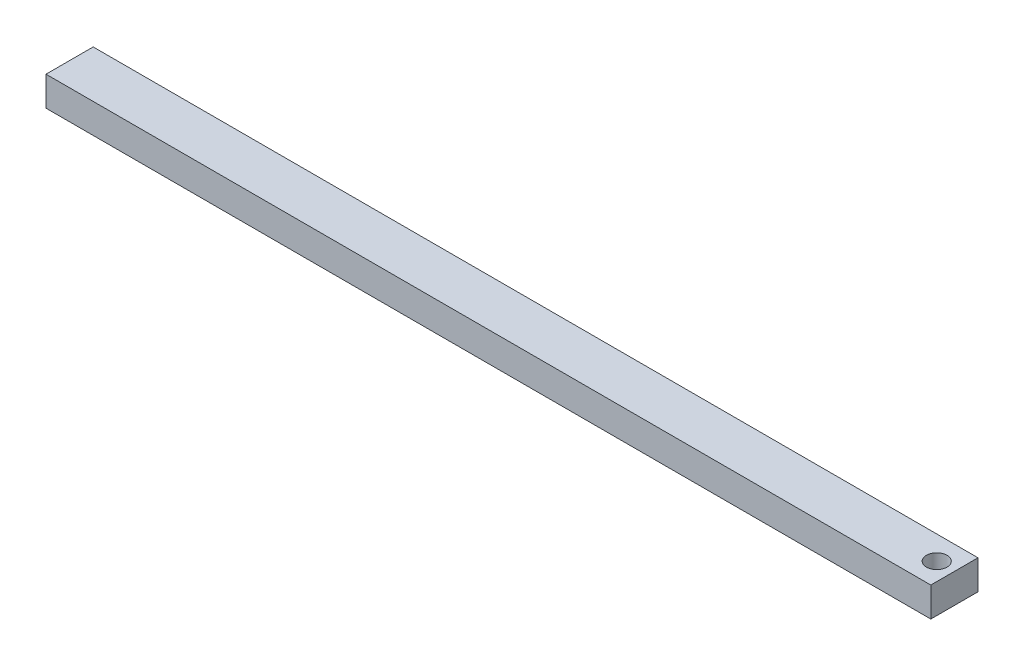
from build123d import *

# Parameters (mm, degrees)
SKETCH1_W           = 150
SKETCH1_H           = 5
BOSS_EXTRUDE1_DEPTH = 8
SKETCH3_R           = 1.75
CUT_EXTRUDE2_DEPTH  = 100.295327837


with BuildPart() as part:
    # Sketch1 → Boss-Extrude1 (new body)
    with BuildSketch(Plane.XY):
        with Locations((23.846153846, 0)):
            Rectangle(SKETCH1_W, SKETCH1_H)
    extrude(amount=-BOSS_EXTRUDE1_DEPTH)

    # Sketch3 → Cut-Extrude2 (cut, through all)
    with BuildSketch(Plane(origin=(0, 2.5, 0), x_dir=(1, 0, 0), z_dir=(0, 1, 0))):
        with Locations((95.846153846, 4)):
            Circle(SKETCH3_R)
    extrude(amount=-CUT_EXTRUDE2_DEPTH, mode=Mode.SUBTRACT)


solid = part.part
